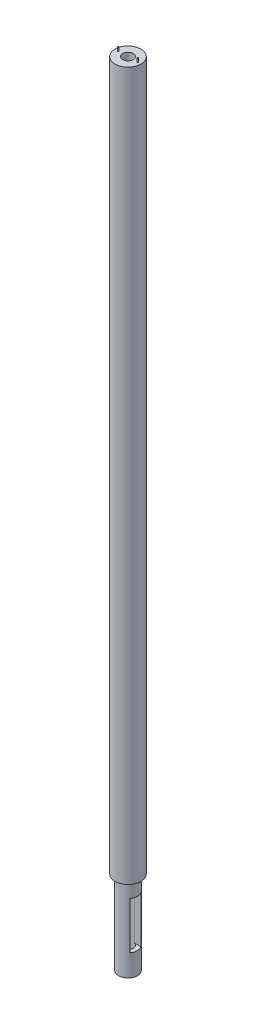
from build123d import *

# Parameters (mm, degrees)
SWEEP3_PROFILE_R   = 4
SWEEP4_PROFILE_R   = 5.5
SKETCH45_R         = 2.25
CUT_EXTRUDE2_DEPTH = 337.377466094
SWEEP5_PROFILE_R   = 0.25
SWEEP6_PROFILE_R   = 0.25
SKETCH72_W         = 4.5
SKETCH72_H         = 20
CUT_EXTRUDE6_DEPTH = 20


with BuildPart() as part:
    # Sweep3: sweep along a path in Sketch31
    with BuildLine(Plane.XY) as sweep3_path:
        Line((0, 0), (0, 35.470165431))
    # Sweep3 profile (on start of the path) → Sweep3 (sweep)
    with BuildSketch(Plane.ZX):
        Circle(SWEEP3_PROFILE_R)
    sweep(path=sweep3_path.line)

    # Sweep4: sweep along a path in Sketch38
    with BuildLine(Plane.XY) as sweep4_path:
        Line((0, 35.470165431), (0, 336.287525335))
    # Sweep4 profile (on start of the path) → Sweep4 (sweep)
    with BuildSketch(Plane.ZX.offset(35.470165431)):
        Circle(SWEEP4_PROFILE_R)
    sweep(path=sweep4_path.line)

    # Sketch45 → Cut-Extrude2 (cut, through all)
    with BuildSketch(Plane(origin=(0, 0, 0), x_dir=(1, 0, 0), z_dir=(0, 1, 0))):
        Circle(SKETCH45_R)
    extrude(amount=CUT_EXTRUDE2_DEPTH, mode=Mode.SUBTRACT)

    # Sweep5: sweep along a curve in space
    with BuildLine() as sweep5_path:
        Line((4.125, 336.287525335, 5.531e-06), (4.125, 337.787525335, 5.531e-06))
    # Sweep5 profile (on start of the path) → Sweep5 (sweep)
    with BuildSketch(Plane(origin=(4.125, 336.287525335, 5.531e-06), x_dir=(0, 0, 1), z_dir=(0, 1, 0))):
        Circle(SWEEP5_PROFILE_R)
    sweep(path=sweep5_path.line)

    # Sweep6: sweep along a curve in space
    with BuildLine() as sweep6_path:
        Line((-4.125, 336.287525335, 9.31e-07), (-4.125, 337.787525335, 9.31e-07))
    # Sweep6 profile (on start of the path) → Sweep6 (sweep)
    with BuildSketch(Plane(origin=(-4.125, 336.287525335, 9.31e-07), x_dir=(0, 0, 1), z_dir=(0, 1, 0))):
        Circle(SWEEP6_PROFILE_R)
    sweep(path=sweep6_path.line)

    # Sketch72 → Cut-Extrude6 (cut)
    with BuildSketch(Plane(origin=(0, 0, 0), x_dir=(0, 0, -1), z_dir=(1, 0, 0))):
        with Locations((-0.068000409, 19.236124066)):
            Rectangle(SKETCH72_W, SKETCH72_H)
    extrude(amount=CUT_EXTRUDE6_DEPTH, mode=Mode.SUBTRACT)


solid = part.part
